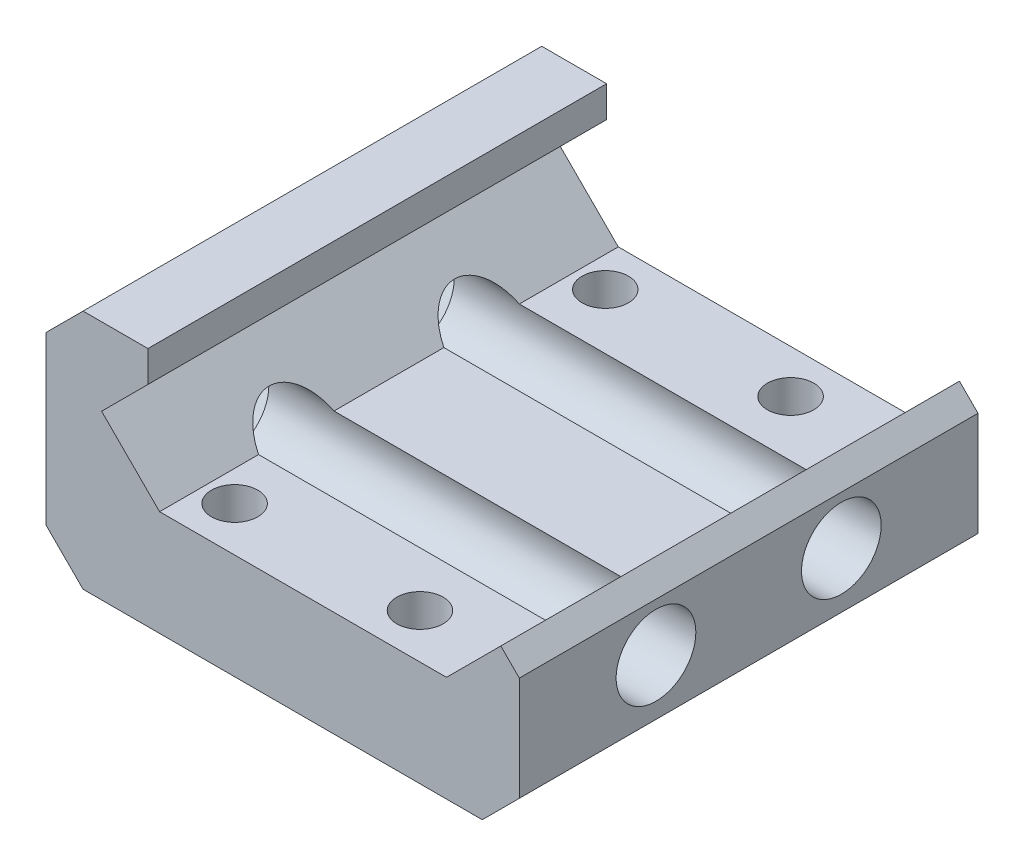
from build123d import *

# Parameters (mm, degrees)
DODANIE_WYCI_GNI_CIE3_DEPTH = 24.75
SZKIC3_R                    = 2.15
WYTNIJ_WYCI_GNI_CIE1_DEPTH  = 37.64214104
CUT_EXTRUDE1_DEPTH          = 35.618008319
CHAMFER1_SIZE               = 2
F_2_5_2_5_DIAMETER_HOLE1_D  = 2.5
CUT_EXTRUDE2_DEPTH          = 2.5


with BuildPart() as part:
    # Szkic1 → Dodanie-wyciągnięcie3 (new body)
    with BuildSketch(Plane.XY):
        Polygon((-3, 4.18), (2.5, 4.18), (2.5, 2.5), (0, 0), (3.13, -3.13), (18.61, -3.13), (22.54, 0.8), (22.54, -6.82), (20.54, -8.82), (-3, -8.82), align=None)
    extrude(amount=DODANIE_WYCI_GNI_CIE3_DEPTH)

    # Szkic3 → Wytnij-wyciągnięcie1 (cut, through all)
    with BuildSketch(Plane(origin=(22.54, 0, 0), x_dir=(0, 0, -1), z_dir=(1, 0, 0))):
        with Locations((-17.375, -3.82)):
            Circle(SZKIC3_R)
        with Locations((-7.375, -3.82)):
            Circle(SZKIC3_R)
    extrude(amount=-WYTNIJ_WYCI_GNI_CIE1_DEPTH, mode=Mode.SUBTRACT)

    # Sketch1 → Cut-Extrude1 (cut, through all)
    with BuildSketch(Plane.XY.offset(24.75)):
        Polygon((22.54, -1.2), (21.54, -0.2), (22.54, 0.8), align=None)
    extrude(amount=-CUT_EXTRUDE1_DEPTH, mode=Mode.SUBTRACT)

    # Chamfer1
    chamfer1_edges = [part.edges().sort_by_distance(p)[0] for p in [
        (-3, 4.18, 12.375),
        (-3, -8.82, 12.375),
    ]]
    chamfer(chamfer1_edges, length=CHAMFER1_SIZE)

    # Ø2.5 (2.5) Diameter Hole1 (through all)
    with Locations(Plane(origin=(0, -8.82, 0), x_dir=(-1, 0, 0), z_dir=(0, -1, 0))):
        with Locations((-4.77, -2.341796682), (-14.77, -2.341796682), (-14.77, -22.341796682), (-4.77, -22.341796682)):
            Hole(F_2_5_2_5_DIAMETER_HOLE1_D / 2)

    # Sketch6 → Cut-Extrude2 (cut)
    with BuildSketch(Plane.ZY.offset(3)):
        Polygon((9.366858429, -7.27), (11.358716857, -3.82), (9.366858429, -0.37), (5.383141571, -0.37), (3.391283143, -3.82), (5.383141571, -7.27), align=None)
        Polygon((15.383141571, -7.27), (19.366858429, -7.27), (21.358716857, -3.82), (19.366858429, -0.37), (15.383141571, -0.37), (13.391283143, -3.82), align=None)
    extrude(amount=-CUT_EXTRUDE2_DEPTH, mode=Mode.SUBTRACT)


solid = part.part
